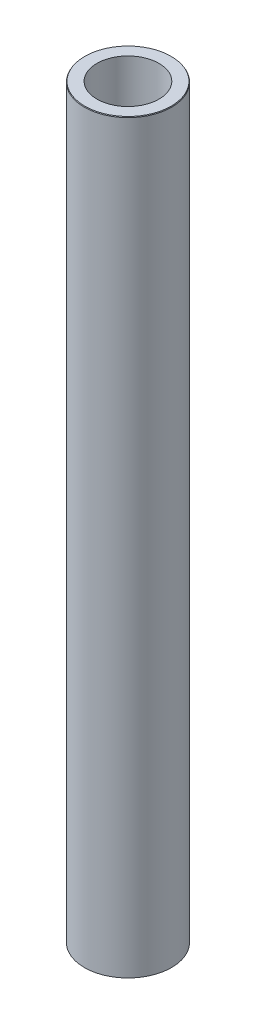
from build123d import *
from OCP.BRepFilletAPI import BRepFilletAPI_MakeChamfer

# Parameters (mm, degrees)
SKETCH1_R           = 15
BOSS_EXTRUDE1_DEPTH = 256.832149543
SKETCH2_R           = 10.676268343
CUT_EXTRUDE1_DEPTH  = 258.706719041
CHAMFER1_SIZE       = 0.246693195
CHAMFER1_SIZE2      = 0.142428383


with BuildPart() as part:
    # Sketch1 → Boss-Extrude1 (new body)
    with BuildSketch(Plane(origin=(0, 0, 0), x_dir=(1, 0, 0), z_dir=(0, 1, 0))):
        Circle(SKETCH1_R)
    extrude(amount=BOSS_EXTRUDE1_DEPTH)

    # Sketch2 → Cut-Extrude1 (cut, through all)
    with BuildSketch(Plane(origin=(0, 0, 0), x_dir=(1, 0, 0), z_dir=(0, 1, 0))):
        Circle(SKETCH2_R)
    extrude(amount=CUT_EXTRUDE1_DEPTH, mode=Mode.SUBTRACT)

    # Chamfer1: one chamfer whose edges measure the first distance from different faces: ONE call of the kernel's chamfer builder (chamfer() names one face for all edges)
    chamfer1_edges_1 = [part.edges().sort_by_distance(p)[0] for p in [
        (-15, 256.832149543, 0),
    ]]
    chamfer1_side_1 = [part.faces().sort_by_distance(p)[0] for p in [
        (-15, 128.416074772, 0),
    ]]
    chamfer1_edges_2 = [part.edges().sort_by_distance(p)[0] for p in [
        (-15, 0, 0),
    ]]
    chamfer1_side_2 = [part.faces().sort_by_distance(p)[0] for p in [
        (-14.575735931, 0, 0),
    ]]
    chamfer1 = BRepFilletAPI_MakeChamfer(part.part.solid().wrapped)
    for e in chamfer1_edges_1:
        chamfer1.Add(CHAMFER1_SIZE, CHAMFER1_SIZE2, e.wrapped, chamfer1_side_1[0].wrapped)  # the first distance lies on this face
    for e in chamfer1_edges_2:
        chamfer1.Add(CHAMFER1_SIZE, CHAMFER1_SIZE2, e.wrapped, chamfer1_side_2[0].wrapped)  # the first distance lies on this face
    add(Compound.cast(chamfer1.Shape()), mode=Mode.REPLACE)


solid = part.part
